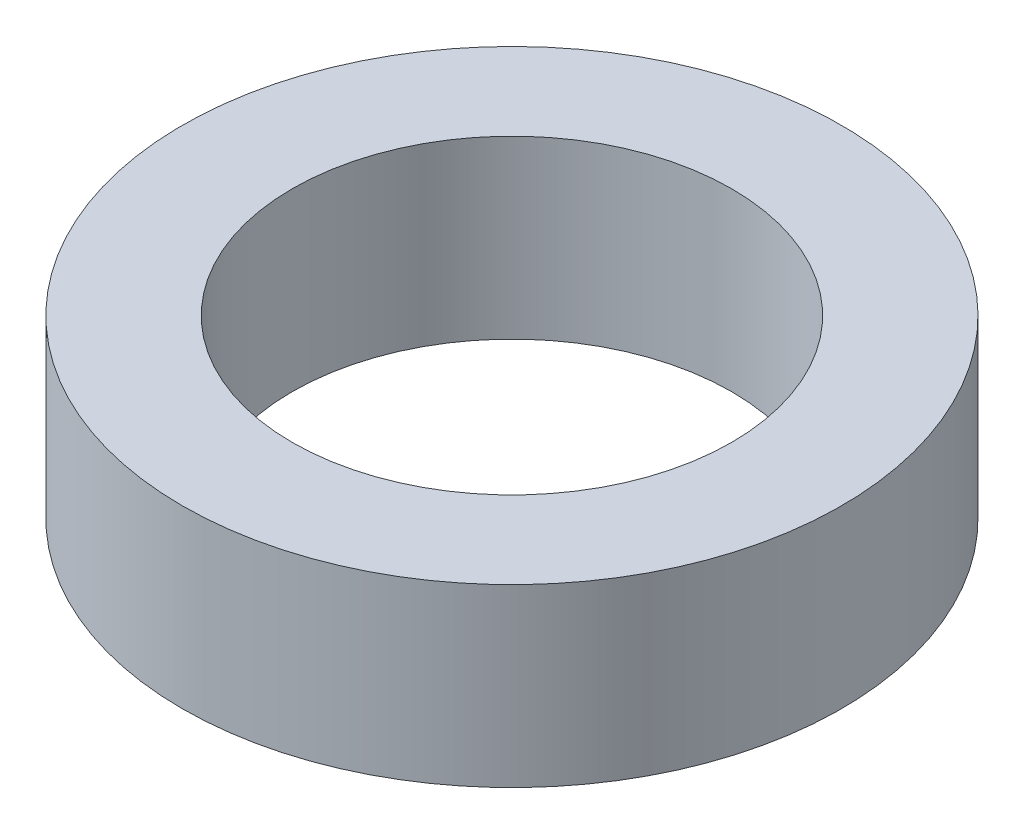
from build123d import *

# Parameters (mm, degrees)
SKETCH1_R           = 7.5
BOSS_EXTRUDE1_DEPTH = 4
SKETCH2_R           = 5
CUT_EXTRUDE1_DEPTH  = 10


with BuildPart() as part:
    # Sketch1 → Boss-Extrude1 (new body)
    with BuildSketch(Plane(origin=(0, 0, 0), x_dir=(1, 0, 0), z_dir=(0, 1, 0))):
        Circle(SKETCH1_R)
    extrude(amount=BOSS_EXTRUDE1_DEPTH)

    # Sketch2 → Cut-Extrude1 (cut)
    with BuildSketch(Plane(origin=(0, 4, 0), x_dir=(1, 0, 0), z_dir=(0, 1, 0))):
        Circle(SKETCH2_R)
    extrude(amount=-CUT_EXTRUDE1_DEPTH, mode=Mode.SUBTRACT)


solid = part.part
